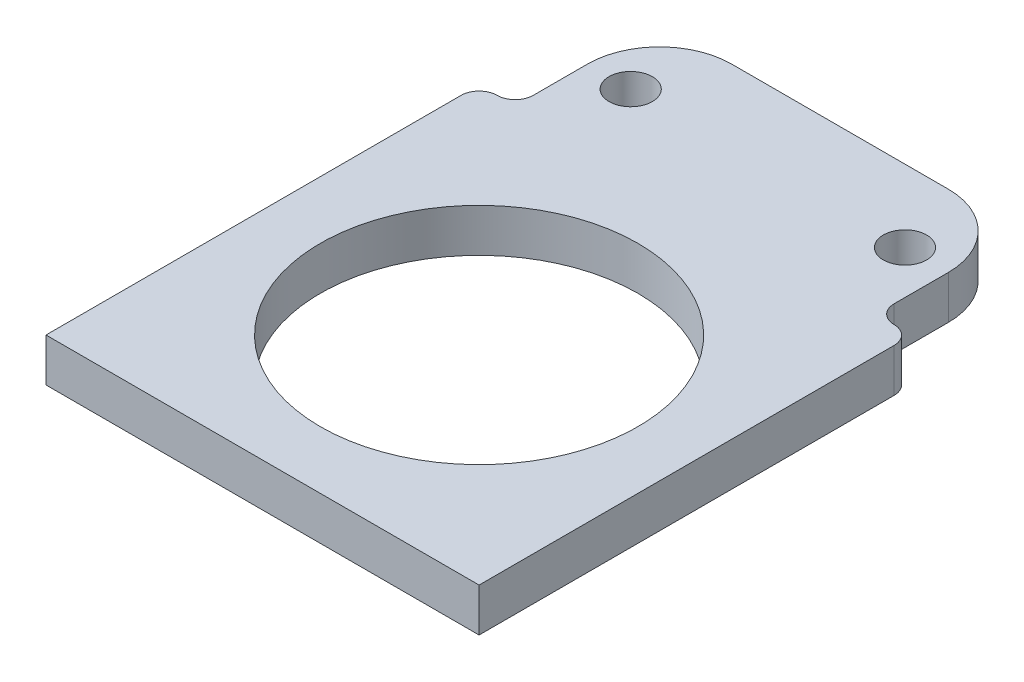
from build123d import *

# Parameters (mm, degrees)
SKETCH_1_W       = 25
SKETCH_1_H       = 10
SKETCH_1_R       = 1.5
EXTRUDE_1_DEPTH  = 3
SKETCH_3_W       = 30
SKETCH_3_H       = 30
SKETCH_3_R       = 11
EXTRUDE_2_DEPTH  = 3
FILLET_START     = -1
FILLET_1_DEPTH   = 5
FILLET_1_2_DEPTH = 3
FILLET_2_R       = 5


with BuildPart() as part:
    # 草图1 → 凸台-拉伸1 (new body)
    with BuildSketch(Plane(origin=(0, 0, 0), x_dir=(1, 0, 0), z_dir=(0, 1, 0))):
        Rectangle(SKETCH_1_W, SKETCH_1_H)
        with Locations(Location((-9.5, 0, 0), (0, 0, 270))):
            Circle(SKETCH_1_R, mode=Mode.SUBTRACT)
        with Locations(Location((9.5, 0, 0), (0, 0, 270))):
            Circle(SKETCH_1_R, mode=Mode.SUBTRACT)
    extrude(amount=EXTRUDE_1_DEPTH)

    # 草图3 → 凸台-拉伸2 (add)
    with BuildSketch(Plane(origin=(0, 3, 0), x_dir=(1, 0, 0), z_dir=(0, 1, 0))):
        with Locations((0, -20)):
            Rectangle(SKETCH_3_W, SKETCH_3_H)
        with Locations(Location((0, -20, 0), (0, 0, 270))):
            Circle(SKETCH_3_R, mode=Mode.SUBTRACT)
    extrude(amount=-EXTRUDE_2_DEPTH)

    # 圆角1: read off the stored shape, not the designer's step
    # 圆角1 outline → 圆角1 (cut)
    with BuildSketch(Plane(origin=(0, 0, 0), x_dir=(1, 0, 0), z_dir=(0, 1, 0)).offset(FILLET_START)):
        with BuildLine():
            ThreePointArc((-15, -6.25), (-14.633883476, -5.366116524), (-13.75, -5))
            Line((-13.75, -5), (-15, -5))
            Line((-15, -5), (-15, -6.25))
        make_face()
        with BuildLine():
            Line((15, -5), (13.75, -5))
            ThreePointArc((13.75, -5), (14.633883476, -5.366116524), (15, -6.25))
            Line((15, -6.25), (15, -5))
        make_face()
    extrude(amount=FILLET_1_DEPTH, mode=Mode.SUBTRACT)

    # Fillet 1 2 outline → Fillet 1 2 (add)
    with BuildSketch(Plane(origin=(0, 0, 0), x_dir=(1, 0, 0), z_dir=(0, 1, 0))):
        with BuildLine():
            Line((-12.5, -5), (-12.5, -3.75))
            ThreePointArc((-12.5, -3.75), (-12.866116524, -4.633883476), (-13.75, -5))
            Line((-13.75, -5), (-12.5, -5))
        make_face()
        with BuildLine():
            ThreePointArc((13.75, -5), (12.866116524, -4.633883476), (12.5, -3.75))
            Line((12.5, -3.75), (12.5, -5))
            Line((12.5, -5), (13.75, -5))
        make_face()
    extrude(amount=FILLET_1_2_DEPTH)

    # 圆角2
    fillet_2_edges = [part.edges().sort_by_distance(p)[0] for p in [
        (-12.5, 1.5, -5),
        (12.5, 1.5, -5),
    ]]
    fillet(fillet_2_edges, radius=FILLET_2_R)


solid = part.part
